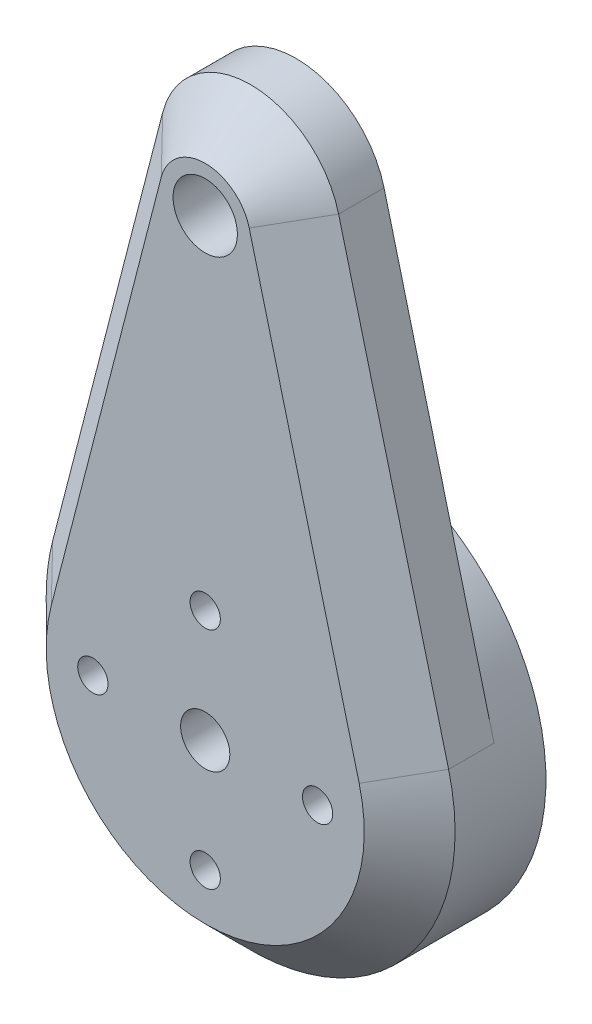
from build123d import *

# Parameters (mm, degrees)
SKETCH1_R           = 2.125
SKETCH1_R_2         = 1.625
BOSS_EXTRUDE1_DEPTH = 6
SKETCH2_R           = 11
CUT_EXTRUDE1_DEPTH  = 2
BOSS_EXTRUDE2_START = 3
SKETCH4_R           = 13.5
SKETCH4_R_2         = 11
BOSS_EXTRUDE2_DEPTH = 3
SKETCH5_R           = 1
CUT_EXTRUDE2_DEPTH  = 39.771768079
CHAMFER1_SIZE       = 3


with BuildPart() as part:
    # Sketch1 → Boss-Extrude1 (new body)
    with BuildSketch(Plane.XY):
        with BuildLine():
            Line((-5.809475019, 31.5), (-13.071318793, 3.375))
            ThreePointArc((-13.071318793, 3.375), (0, -13.5), (13.071318793, 3.375))
            Line((13.071318793, 3.375), (5.809475019, 31.5))
            ThreePointArc((5.809475019, 31.5), (0, 36), (-5.809475019, 31.5))
        make_face()
        with Locations((0, 30)):
            Circle(SKETCH1_R, mode=Mode.SUBTRACT)
        Circle(SKETCH1_R_2, mode=Mode.SUBTRACT)
    extrude(amount=BOSS_EXTRUDE1_DEPTH)

    # Sketch2 → Cut-Extrude1 (cut)
    with BuildSketch(Plane(origin=(0, 0, 0), x_dir=(-1, 0, 0), z_dir=(0, 0, -1))):
        Circle(SKETCH2_R)
    extrude(amount=-CUT_EXTRUDE1_DEPTH, mode=Mode.SUBTRACT)

    # Sketch4 → Boss-Extrude2 (add)
    with BuildSketch(Plane(origin=(0, 0, 0), x_dir=(-1, 0, 0), z_dir=(0, 0, -1)).offset(BOSS_EXTRUDE2_START)):
        Circle(SKETCH4_R)
        Circle(SKETCH4_R_2, mode=Mode.SUBTRACT)
    extrude(amount=-BOSS_EXTRUDE2_DEPTH)

    # Sketch5 → Cut-Extrude2 (cut, through all)
    with BuildSketch(Plane(origin=(0, 0, 2), x_dir=(-1, 0, 0), z_dir=(0, 0, -1))):
        with Locations((7.42, 0)):
            Circle(SKETCH5_R)
        with Locations((0, -7.42)):
            Circle(SKETCH5_R)
        with Locations((-7.42, 0)):
            Circle(SKETCH5_R)
        with Locations((0, 7.42)):
            Circle(SKETCH5_R)
    extrude(amount=-CUT_EXTRUDE2_DEPTH, mode=Mode.SUBTRACT)

    # Chamfer1
    chamfer1_edges = [part.edges().sort_by_distance(p)[0] for p in [
        (0, -13.5, 6),
        (-9.440396906, 17.4375, 6),
        (0, 36, 6),
        (9.440396906, 17.4375, 6),
    ]]
    chamfer(chamfer1_edges, length=CHAMFER1_SIZE)


solid = part.part
